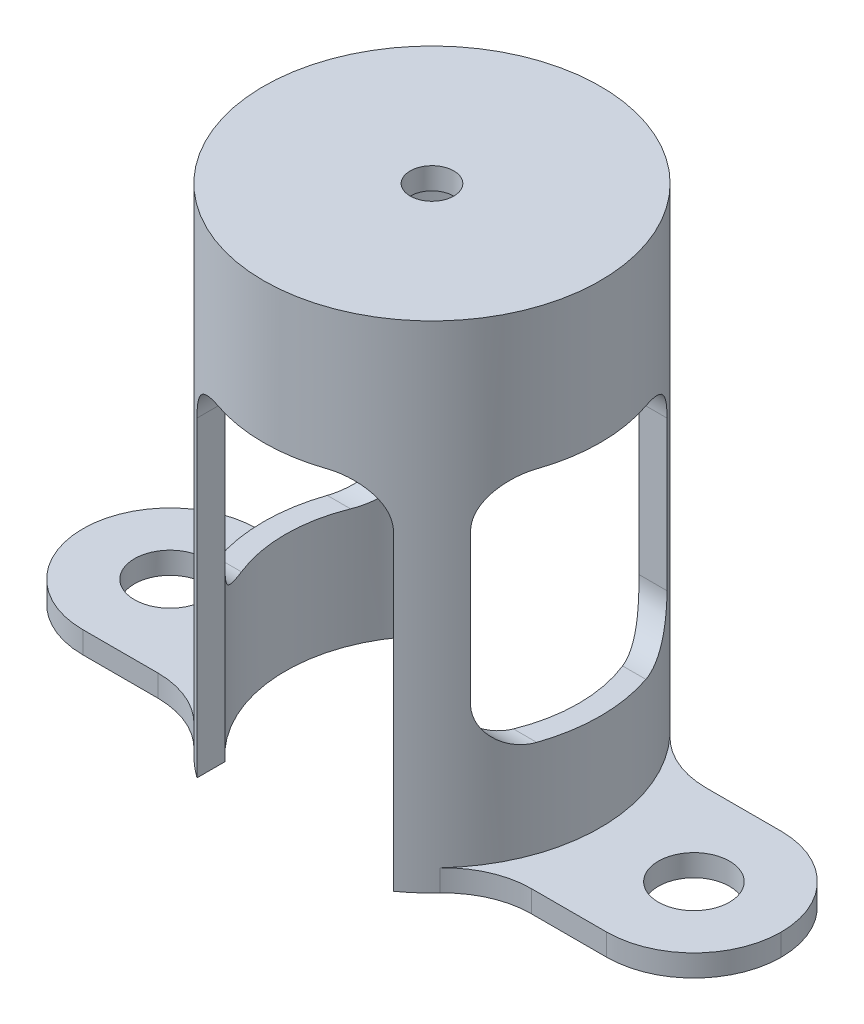
from build123d import *

# Parameters (mm, degrees)
SKETCH2_R           = 7.715
BOSS_EXTRUDE1_DEPTH = 21.7
SKETCH4_R           = 1
CUT_EXTRUDE2_DEPTH  = 25.288525068
BOSS_EXTRUDE2_START = 1
SKETCH11_R          = 6.715
BOSS_EXTRUDE2_DEPTH = 1
SKETCH12_R          = 6.715
CUT_EXTRUDE7_DEPTH  = 20.7
CUT_EXTRUDE8_START  = -1
CUT_EXTRUDE8_DEPTH  = 16.275
SKETCH14_W          = 9
SKETCH14_H          = 10.85
CUT_EXTRUDE9_DEPTH  = 52.443281631
FILLET3_R           = 2
FILLET4_R           = 4
CUT_EXTRUDE10_REACH = 30.043
SKETCH15_R          = 1.63


# Read off the part's stored shape, not the designer's step: Cut-Extrude8
with BuildPart() as part:
    # Sketch2 → Boss-Extrude1 (new body)
    with BuildSketch(Plane(origin=(0, 0, 0), x_dir=(1, 0, 0), z_dir=(0, 1, 0))):
        with Locations(Location((0, 0, 0), (0, 0, 270))):
            Circle(SKETCH2_R)
    extrude(amount=BOSS_EXTRUDE1_DEPTH)

    # Sketch4 → Cut-Extrude2 (cut, through all)
    with BuildSketch(Plane(origin=(0, 21.7, 0), x_dir=(1, 0, 0), z_dir=(0, 1, 0))):
        with Locations(Location((0, 0, 0), (0, 0, 270))):
            Circle(SKETCH4_R)
    extrude(amount=-CUT_EXTRUDE2_DEPTH, mode=Mode.SUBTRACT)

    # Sketch11 → Boss-Extrude2 (add)
    with BuildSketch(Plane.XZ.offset(BOSS_EXTRUDE2_START)):
        with BuildLine():
            Line((6.597061846, 4), (16, 4))
            Line((16, 4), (16, -4))
            Line((16, -4), (6.597061846, -4))
            ThreePointArc((6.597061846, -4), (0, -7.715), (-6.597061846, -4))
            Line((-6.597061846, -4), (-16, -4))
            Line((-16, -4), (-16, 4))
            Line((-16, 4), (-6.597061846, 4))
            ThreePointArc((-6.597061846, 4), (0, 7.715), (6.597061846, 4))
        make_face()
        with Locations(Location((0, 0, 0), (0, 0, 270))):
            Circle(SKETCH11_R, mode=Mode.SUBTRACT)
    extrude(amount=-BOSS_EXTRUDE2_DEPTH)

    # Sketch12 → Cut-Extrude7 (cut)
    with BuildSketch(Plane.XZ):
        with Locations(Location((0, 0, 0), (0, 0, 270))):
            Circle(SKETCH12_R)
    extrude(amount=-CUT_EXTRUDE7_DEPTH, mode=Mode.SUBTRACT)

    # Cut-Extrude8 outline → Cut-Extrude8 (cut)
    with BuildSketch(Plane(origin=(0, 0, 0), x_dir=(1, 0, 0), z_dir=(0, 1, 0)).offset(CUT_EXTRUDE8_START)):
        with BuildLine():
            ThreePointArc((4.5, -4.98409721), (0, -6.715), (-4.5, -4.98409721))
            Line((-4.5, -4.98409721), (-4.5, -6.266675754))
            ThreePointArc((-4.5, -6.266675754), (0, -7.715), (4.5, -6.266675754))
            Line((4.5, -6.266675754), (4.5, -4.98409721))
        make_face()
        with BuildLine():
            Line((-4.5, 6.266675754), (-4.5, 4.98409721))
            ThreePointArc((-4.5, 4.98409721), (0, 6.715), (4.5, 4.98409721))
            Line((4.5, 4.98409721), (4.5, 6.266675754))
            ThreePointArc((4.5, 6.266675754), (0, 7.715), (-4.5, 6.266675754))
        make_face()
    extrude(amount=CUT_EXTRUDE8_DEPTH, mode=Mode.SUBTRACT)

    # Sketch14 → Cut-Extrude9 (cut, through all)
    with BuildSketch(Plane(origin=(30, 0, 0), x_dir=(0, 0, -1), z_dir=(1, 0, 0))):
        with Locations((0, 9.85)):
            Rectangle(SKETCH14_W, SKETCH14_H)
    extrude(amount=-CUT_EXTRUDE9_DEPTH, mode=Mode.SUBTRACT)

    # Fillet3
    fillet3_edges = [part.edges().sort_by_distance(p)[0] for p in [
        (4.5, 15.275, 5.625386482),
        (4.5, 15.275, -5.625386482),
        (-4.5, 15.275, -5.625386482),
        (-4.5, 15.275, 5.625386482),
        (5.625386482, 15.275, -4.5),
        (-5.625386482, 15.275, -4.5),
        (5.625386482, 4.425, -4.5),
        (-5.625386482, 4.425, -4.5),
        (-5.625386482, 4.425, 4.5),
        (5.625386482, 4.425, 4.5),
        (5.625386482, 15.275, 4.5),
        (-5.625386482, 15.275, 4.5),
    ]]
    fillet(fillet3_edges, radius=FILLET3_R)

    # Fillet4
    # the kernel refuses this fillet: 4 mm, written as the material it adds along each edge
    with BuildSketch(Plane(origin=(6.597061846, -1, -4), x_dir=(-0.6038984095873641, 0, -0.797061296825942), z_dir=(0, 1, 0)), Plane(origin=(-6.597061846, -1, 4), x_dir=(0.6038984095873637, 0, 0.7970612968259423), z_dir=(0, 1, 0))) as fillet4_piece_1:
        with BuildLine():
            CenterArc((2.003972094, -3.978668209), FILLET4_R, 95.919901586, 46.930484551)
            Line((-1.184273093, -1.563074571), (0, 0))
            ThreePointArc((0, 0), (0.795709969, -0.041143691), (1.591419939, 0))
        make_face()
    extrude(amount=1)
    with BuildSketch(Plane(origin=(6.597061846, -1, 4), x_dir=(-0.6038984095873636, 0, 0.7970612968259423), z_dir=(0, 1, 0)), Plane(origin=(-6.597061846, -1, -4), x_dir=(0.6038984095873643, 0, -0.7970612968259416), z_dir=(0, 1, 0))) as fillet4_piece_2:
        with BuildLine():
            CenterArc((2.003972094, 3.978668209), FILLET4_R, 217.149613863, 46.930484551)
            Line((-1.184273093, 1.563074571), (0, 0))
            ThreePointArc((0, 0), (0.795709969, 0.041143691), (1.591419939, 0))
        make_face()
    extrude(amount=1)
    # the kernel refuses this fillet: 4 mm, written as the material it takes off along each edge
    with BuildSketch(Plane(origin=(16, -11, -4), x_dir=(0, 0, 1), z_dir=(0, 1, 0)), Plane(origin=(16, -11, 4), x_dir=(-1, 0, 0), z_dir=(0, 1, 0))) as fillet4_2_piece_1:
        with BuildLine():
            CenterArc((FILLET4_R, -FILLET4_R), FILLET4_R, 90, 90)
            Line((0, -FILLET4_R), (0, 0))
            Line((0, 0), (FILLET4_R, 0))
        make_face()
    extrude(amount=21, mode=Mode.SUBTRACT)
    with BuildSketch(Plane(origin=(-16, -11, -4), x_dir=(0, 0, 1), z_dir=(0, 1, 0)), Plane(origin=(-16, -11, 4), x_dir=(1, 0, 0), z_dir=(0, 1, 0))) as fillet4_2_piece_2:
        with BuildLine():
            CenterArc((FILLET4_R, FILLET4_R), FILLET4_R, 180, 90)
            Line((0, FILLET4_R), (0, 0))
            Line((0, 0), (FILLET4_R, 0))
        make_face()
    extrude(amount=21, mode=Mode.SUBTRACT)

    # Sketch15 → Cut-Extrude10 (cut, up to next)
    with BuildSketch(Plane(origin=(0, 0, 0), x_dir=(1, 0, 0), z_dir=(0, 1, 0)), mode=Mode.PRIVATE) as cut_extrude10_sk1:
        with Locations(Location((-12, 0, 0), (0, 0, 270))):
            Circle(SKETCH15_R)
    cut_extrude10_tool1 = extrude(cut_extrude10_sk1.sketch, amount=-CUT_EXTRUDE10_REACH, mode=Mode.PRIVATE) & part.part
    # Sketch15 → Cut-Extrude10 (cut, up to next)
    with BuildSketch(Plane(origin=(0, 0, 0), x_dir=(1, 0, 0), z_dir=(0, 1, 0)), mode=Mode.PRIVATE) as cut_extrude10_sk2:
        with Locations(Location((12, 0, 0), (0, 0, 270))):
            Circle(SKETCH15_R)
    cut_extrude10_tool2 = extrude(cut_extrude10_sk2.sketch, amount=-CUT_EXTRUDE10_REACH, mode=Mode.PRIVATE) & part.part
    add(cut_extrude10_tool1.solids().sort_by_distance((-12, 0, 0))[0], mode=Mode.SUBTRACT)
    add(cut_extrude10_tool2.solids().sort_by_distance((12, 0, 0))[0], mode=Mode.SUBTRACT)


solid = part.part
